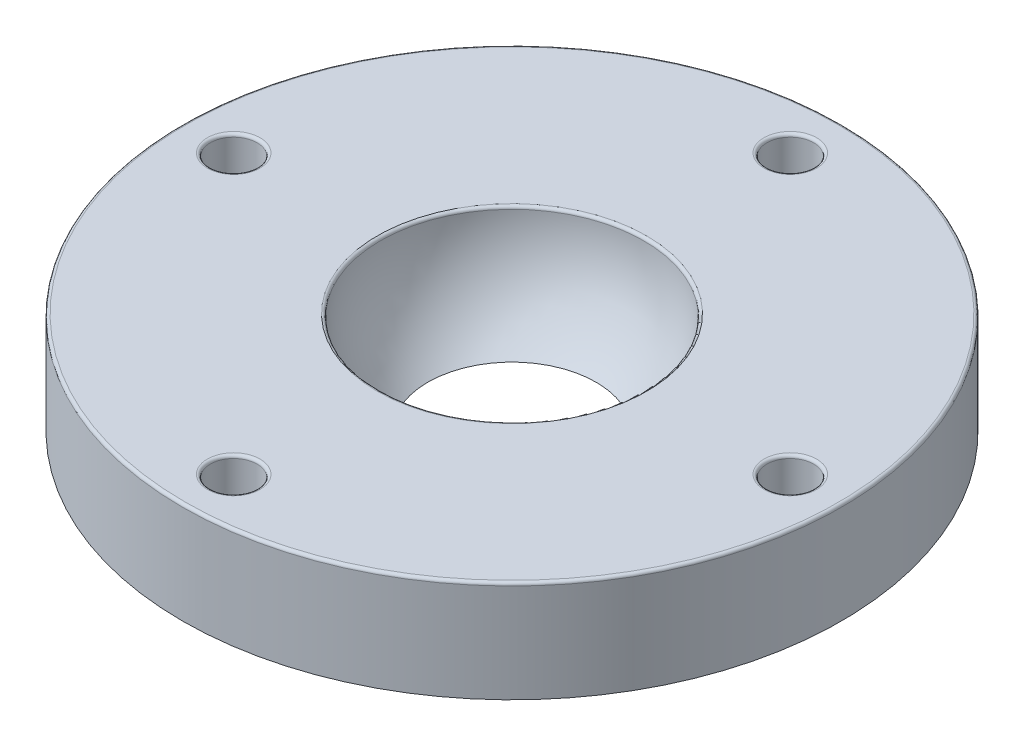
from build123d import *

# Parameters (mm, degrees)
SKETCH2_R          = 1.6
CUT_EXTRUDE1_DEPTH = 33.565318976
FILLET1_R          = 0.2


with BuildPart() as part:
    # Sketch1 → Revolve1 (revolve)
    with BuildSketch(Plane.XY):
        with BuildLine():
            Line((-22.5, 0), (-5.744562647, 0))
            ThreePointArc((-5.744562647, 0), (-8.145583583, 3.100740874), (-9, 6.92820323))
            Line((-9, 6.92820323), (-22.5, 6.92820323))
            Line((-22.5, 6.92820323), (-22.5, 0))
        make_face()
    revolve(axis=Axis((0, 6.92820323, 0), (0, 1, 0)))

    # Sketch2 → Cut-Extrude1 (cut, through all)
    with BuildSketch(Plane(origin=(0, 6.92820323, 0), x_dir=(1, 0, 0), z_dir=(0, 1, 0))):
        with Locations((-19, 0)):
            Circle(SKETCH2_R)
        with Locations((0, 19)):
            Circle(SKETCH2_R)
        with Locations((19, 0)):
            Circle(SKETCH2_R)
        with Locations((0, -19)):
            Circle(SKETCH2_R)
    extrude(amount=-CUT_EXTRUDE1_DEPTH, mode=Mode.SUBTRACT)

    # Fillet1
    fillet1_edges = [part.edges().sort_by_distance(p)[0] for p in [
        (22.5, 6.92820323, 0),
        (9, 6.92820323, 0),
        (-20.6, 6.92820323, 0),
        (-1.6, 6.92820323, -19),
        (17.4, 6.92820323, 0),
        (-1.6, 6.92820323, 19),
    ]]
    fillet(fillet1_edges, radius=FILLET1_R)


solid = part.part
